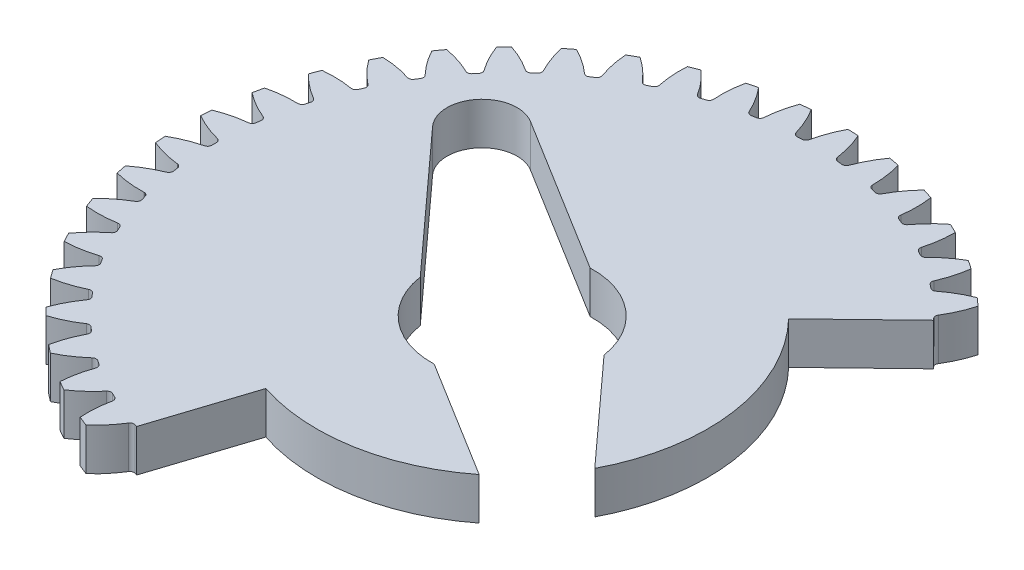
from build123d import *

# Parameters (mm, degrees)
SALIENTE_EXTRUIR1_DEPTH = 3
REDONDEO1_R             = 0.3
MATRIZC1_COUNT          = 45
REDONDEO1_OF_MATRIZC1_R = 0.3
CROQUIS4_R              = 2.5
CORTAR_EXTRUIR1_DEPTH   = 3
CORTAR_EXTRUIR2_DEPTH   = 10
CORTAR_EXTRUIR6_DEPTH   = 10


with BuildPart() as part:
    # Croquis3 → Saliente-Extruir1 (new body)
    with BuildSketch(Plane(origin=(0, 0, 0), x_dir=(1, 0, 0), z_dir=(0, 1, 0))):
        with BuildLine():
            ThreePointArc((1.195722559, 23.469560021), (0.820306667, 23.48567855), (0.444681042, 23.495792363))
            ThreePointArc((0.444681042, 23.495792363), (-0.034902232, 22.402055461), (-0.339488278, 21.247288008))
            ThreePointArc((-0.339488278, 21.247288008), (-0.741766667, -21.237049753), (1.821100977, 21.171823049))
            ThreePointArc((1.821100977, 21.171823049), (1.597826227, 22.345027598), (1.195722559, 23.469560021))
        make_face()
    saliente_extruir1 = extrude(amount=SALIENTE_EXTRUIR1_DEPTH)

    # Redondeo1
    redondeo1_edges = [part.edges().sort_by_distance(p)[0] for p in [
        (1.821100977, 1.5, -21.171823049),
        (-0.339488278, 1.5, -21.247288008),
    ]]
    fillet(redondeo1_edges, radius=REDONDEO1_R)

    # MatrizC1: Saliente-Extruir1 ×45 about axis
    matrizc1_axis = Axis((0, 0, 0), (0, 1, 0))
    for i in range(1, MATRIZC1_COUNT):
        add(saliente_extruir1.rotate(matrizc1_axis, i * 360 / MATRIZC1_COUNT))

    # Redondeo1 of MatrizC1
    redondeo1_of_matrizc1_edges = [part.edges().sort_by_distance(p)[0] for p in [
        (-1.143170119, 1.5, -21.219228593),
        (-3.293235361, 1.5, -20.993263226),
        (-4.085190709, 1.5, -20.853625989),
        (-6.182883363, 1.5, -20.330628454),
        (-6.947697709, 1.5, -20.082131275),
        (-8.952188573, 1.5, -19.272281125),
        (-9.674975676, 1.5, -18.919760719),
        (-11.547249616, 1.5, -17.838820765),
        (-12.213941246, 1.5, -17.389138542),
        (-13.91755658, 1.5, -16.058148051),
        (-14.515176344, 1.5, -15.520056563),
        (-16.016974136, 1.5, -13.964921751),
        (-16.533890044, 1.5, -13.348894336),
        (-17.80463951, 1.5, -11.599884134),
        (-18.230790382, 1.5, -10.917911066),
        (-19.245757828, 1.5, -9.009067967),
        (-19.572849122, 1.5, -8.274423076),
        (-20.312279361, 1.5, -6.24290054),
        (-20.533944618, 1.5, -5.469882852),
        (-20.983445482, 1.5, -3.355222155),
        (-21.095370239, 1.5, -2.558877581),
        (-21.246192705, 1.5, -0.402238187),
        (-21.246198474, 1.5, 0.401933332),
        (-21.095406953, 1.5, 2.55857489),
        (-20.983493623, 1.5, 3.35492107),
        (-20.534023102, 1.5, 5.469588217),
        (-20.312368936, 1.5, 6.242609085),
        (-19.572967847, 1.5, 8.27414223),
        (-19.245887094, 1.5, 9.008791815),
        (-18.230947038, 1.5, 10.917649477),
        (-17.804805951, 1.5, 11.59962866),
        (-16.534081581, 1.5, 13.348657096),
        (-16.017174513, 1.5, 13.964691928),
        (-14.515399034, 1.5, 15.519848288),
        (-13.917786992, 1.5, 16.057948351),
        (-12.214190756, 1.5, 17.388963286),
        (-11.547505578, 1.5, 17.838655076),
        (-9.675247148, 1.5, 18.919621894),
        (-8.952465104, 1.5, 19.272152671),
        (-6.94798586, 1.5, 20.082031583),
        (-6.18317508, 1.5, 20.330539735),
        (-4.085489931, 1.5, 20.853567369),
        (-3.293536586, 1.5, 20.99321597),
        (-1.143474586, 1.5, 21.219212188),
        (-0.339793148, 1.5, 21.247283135),
        (1.82079719, 1.5, 21.171849177),
        (2.620563976, 1.5, 21.087796102),
        (4.74962922, 1.5, 20.712400206),
        (5.529914804, 1.5, 20.517859105),
        (7.58601512, 1.5, 19.849807924),
        (8.33163213, 1.5, 19.54856532),
        (10.274747864, 1.5, 18.600861709),
        (10.971183713, 1.5, 18.198780946),
        (12.763494329, 1.5, 16.98987088),
        (13.397193686, 1.5, 16.494778002),
        (15.003813895, 1.5, 15.04819154),
        (15.562442522, 1.5, 14.469722967),
        (16.95210129, 1.5, 12.813616268),
        (17.424786116, 1.5, 12.163031234),
        (18.570435316, 1.5, 10.329638531),
        (18.94797607, 1.5, 9.619599933),
        (19.827316942, 1.5, 7.64460613),
        (20.102365222, 1.5, 6.888934061),
        (20.698282397, 1.5, 4.810780166),
        (20.865484701, 1.5, 4.024182924),
        (21.166379329, 1.5, 1.883317838),
        (21.222481254, 1.5, 1.081105643),
        (21.222496765, 1.5, -1.080801129),
        (21.16640635, 1.5, -1.883014129),
        (20.86554244, 1.5, -4.023883531),
        (20.698351423, 1.5, -4.810483173),
        (20.102464067, 1.5, -6.888645618),
        (19.82742663, 1.5, -7.644321634),
        (18.948114096, 1.5, -9.619328053),
        (18.57058353, 1.5, -10.329372069),
        (17.424960638, 1.5, -12.16278121),
        (16.952285146, 1.5, -12.813373027),
        (15.562650142, 1.5, -14.469499666),
        (15.004029815, 1.5, -15.047976253),
        (13.397430362, 1.5, -16.494585769),
        (12.76373811, 1.5, -16.989687739),
        (10.971444841, 1.5, -18.198623522),
        (10.275014761, 1.5, -18.600714278),
        (8.331912625, 1.5, -19.54844577),
        (7.586299937, 1.5, -19.849699072),
        (5.530209207, 1.5, -20.517779756),
        (4.749926415, 1.5, -20.712332053),
        (2.620866558, 1.5, -21.087758498),
    ]]
    fillet(redondeo1_of_matrizc1_edges, radius=REDONDEO1_OF_MATRIZC1_R)

    # Croquis4 → Cortar-Extruir1 (cut)
    with BuildSketch(Plane(origin=(0, 3, 0), x_dir=(1, 0, 0), z_dir=(0, 1, 0))):
        with Locations(Location((0, 0, 0), (0, 0, 270))):
            Circle(CROQUIS4_R)
    extrude(amount=-CORTAR_EXTRUIR1_DEPTH, mode=Mode.SUBTRACT)

    # Croquis5 → Cortar-Extruir2 (cut)
    with BuildSketch(Plane.XZ):
        with BuildLine():
            Line((-5.684329069, 0.866546617), (-14.537917823, -8.864971815))
            ThreePointArc((-14.537917823, -8.864971815), (-14.611237857, -12.145440638), (-11.372620445, -12.672895649))
            Line((-11.372620445, -12.672895649), (-0.186919096, -5.746961045))
            ThreePointArc((-0.186919096, -5.746961045), (3.675593877, -4.421821983), (5.684329069, -0.866546617))
            Line((5.684329069, -0.866546617), (14.537917823, 8.864971815))
            ThreePointArc((14.537917823, 8.864971815), (14.611237857, 12.145440638), (11.372620445, 12.672895649))
            Line((11.372620445, 12.672895649), (0.186919096, 5.746961045))
            ThreePointArc((0.186919096, 5.746961045), (-3.675593877, 4.421821983), (-5.684329069, 0.866546617))
        make_face()
    extrude(amount=-CORTAR_EXTRUIR2_DEPTH, mode=Mode.SUBTRACT)

    # Croquis8 → Cortar-Extruir6 (cut)
    with BuildSketch(Plane(origin=(0, 3, 0), x_dir=(1, 0, 0), z_dir=(0, 1, 0))):
        with BuildLine():
            Line((-4.307884845, -13.257982621), (-6.566756123, -20.20990386))
            Line((-6.566756123, -20.20990386), (-8.056507827, -24.79477623))
            ThreePointArc((-8.056507827, -24.79477623), (22.109219764, -13.81559438), (18.753916538, 18.110186667))
            Line((18.753916538, 18.110186667), (15.286076661, 14.761380705))
            Line((15.286076661, 14.761380705), (10.027882375, 9.683674411))
            ThreePointArc((10.027882375, 9.683674411), (11.821992209, -7.387318542), (-4.307884845, -13.257982621))
        make_face()
    extrude(amount=-CORTAR_EXTRUIR6_DEPTH, mode=Mode.SUBTRACT)


solid = part.part
